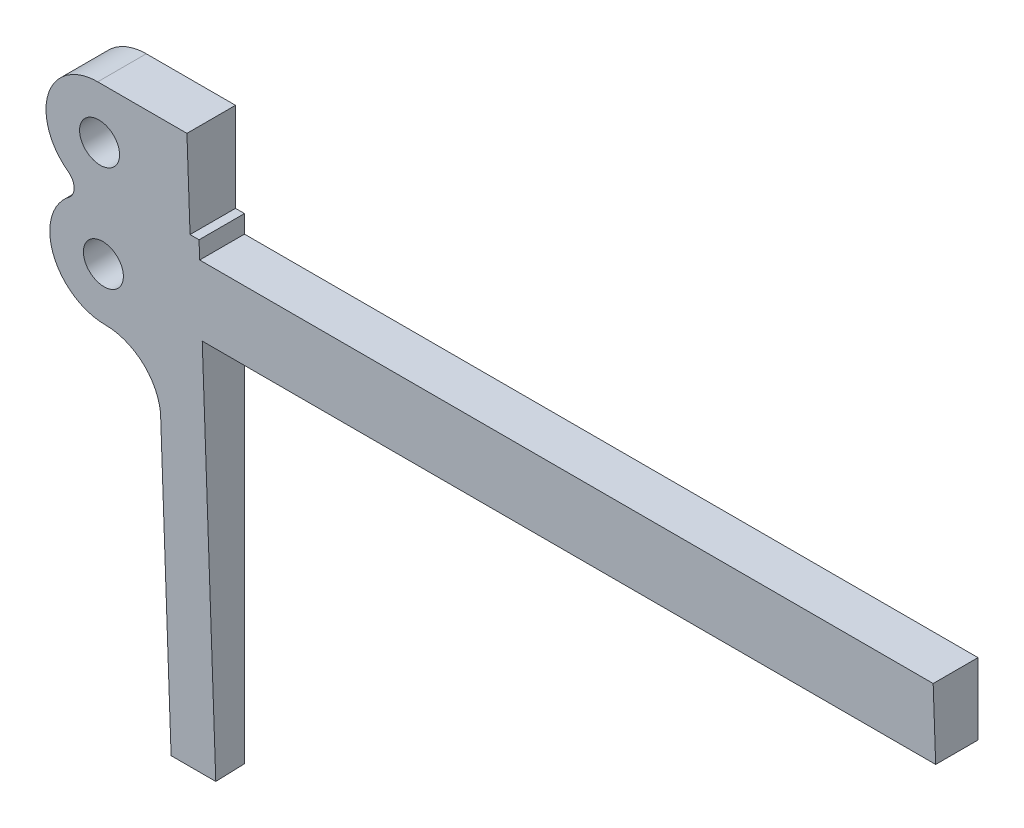
from build123d import *

# Parameters (mm, degrees)
BOSS_EXTRUDE1_OUTLINE_R = 3.556
BOSS_EXTRUDE1_OUTLINE_W = 260.9469
BOSS_EXTRUDE1_OUTLINE_H = 138.1252
BOSS_EXTRUDE1_DEPTH     = 76.2
CUT_EXTRUDE1_DEPTH      = 355.32482824
CUT_EXTRUDE1_DEPTH_BACK = 355.32482824
FILLET1_R               = 2.54
SKETCH7_W               = 260.9469
SKETCH7_H               = 22.1996
CUT_EXTRUDE2_DEPTH      = 347.152897849
FILLET2_R               = 6.35
SKETCH8_W               = 217.439036591
SKETCH8_H               = 235.521960295
CUT_EXTRUDE4_DEPTH      = 347.144751077
SKETCH9_W               = 181.772335281
SKETCH9_H               = 128.639747743
CUT_EXTRUDE5_DEPTH      = 347.144751077


# Read off the part's stored shape, not the designer's step: Boss-Extrude1
with BuildPart() as part:
    # Boss-Extrude1 outline → Boss-Extrude1 (new body)
    with BuildSketch(Plane.XY):
        with BuildLine():
            Line((-286.3596, -22.225), (9.525, -22.225))
            ThreePointArc((9.525, -22.225), (19.05, -12.7), (9.525, -3.175))
            ThreePointArc((9.525, -3.175), (19.05, 6.35), (9.525, 15.875))
            ThreePointArc((9.525, 15.875), (2.789807909, 18.664807909), (0, 25.4))
            Line((0, 25.4), (0, 131.7752))
            ThreePointArc((0, 131.7752), (2.789807909, 138.510392091), (9.525, 141.3002))
            ThreePointArc((9.525, 141.3002), (19.05, 150.8252), (9.525, 160.3502))
            ThreePointArc((9.525, 160.3502), (19.05, 169.8752), (9.525, 179.4002))
            Line((9.525, 179.4002), (-6.35, 179.4002))
            Line((-6.35, 179.4002), (-6.35, 163.5252))
            Line((-6.35, 163.5252), (-7.9502, 163.5252))
            Line((-7.9502, 163.5252), (-7.9502, 160.3502))
            Line((-7.9502, 160.3502), (-268.9098, 160.3502))
            Line((-268.9098, 160.3502), (-268.9098, 163.5252))
            Line((-268.9098, 163.5252), (-270.51, 163.5252))
            Line((-270.51, 163.5252), (-270.51, 179.4002))
            Line((-270.51, 179.4002), (-286.385, 179.4002))
            ThreePointArc((-286.385, 179.4002), (-295.91, 169.8752), (-286.385, 160.3502))
            ThreePointArc((-286.385, 160.3502), (-295.897297883, 150.818850004), (-286.3723, 141.3002))
            ThreePointArc((-286.3723, 141.3002), (-279.637107909, 138.510392091), (-276.8473, 131.7752))
            Line((-276.8473, 131.7752), (-276.8473, 25.4))
            ThreePointArc((-276.8473, 25.4), (-279.637107909, 18.664807909), (-286.3723, 15.875))
            ThreePointArc((-286.3723, 15.875), (-295.8973, 6.35), (-286.3723, -3.175))
            ThreePointArc((-286.3723, -3.175), (-295.884597883, -12.706349996), (-286.3596, -22.225))
        make_face()
        with Locations((-286.3596, -12.7)):
            Circle(BOSS_EXTRUDE1_OUTLINE_R, mode=Mode.SUBTRACT)
        with Locations((-286.3723, 6.35)):
            Circle(BOSS_EXTRUDE1_OUTLINE_R, mode=Mode.SUBTRACT)
        with Locations((9.525, -12.7)):
            Circle(BOSS_EXTRUDE1_OUTLINE_R, mode=Mode.SUBTRACT)
        with Locations((9.525, 6.35)):
            Circle(BOSS_EXTRUDE1_OUTLINE_R, mode=Mode.SUBTRACT)
        with Locations((-286.3723, 150.8252)):
            Circle(BOSS_EXTRUDE1_OUTLINE_R, mode=Mode.SUBTRACT)
        with Locations((-286.385, 169.8752)):
            Circle(BOSS_EXTRUDE1_OUTLINE_R, mode=Mode.SUBTRACT)
        with Locations((-138.42365, 78.5876)):
            Rectangle(BOSS_EXTRUDE1_OUTLINE_W, BOSS_EXTRUDE1_OUTLINE_H, mode=Mode.SUBTRACT)
        with Locations((9.525, 150.8252)):
            Circle(BOSS_EXTRUDE1_OUTLINE_R, mode=Mode.SUBTRACT)
        with Locations((9.525, 169.8752)):
            Circle(BOSS_EXTRUDE1_OUTLINE_R, mode=Mode.SUBTRACT)
    extrude(amount=BOSS_EXTRUDE1_DEPTH)

    # Sketch5 → Cut-Extrude1 (cut, two sides: drawn at the far end of the back side and taken through both)
    with BuildSketch(Plane.ZY.offset(276.8473).offset(-CUT_EXTRUDE1_DEPTH_BACK)):
        Polygon((1.6002, -22.225), (8.641107133, 179.4002), (76.2, 179.4002), (76.2, -22.225), align=None)
    extrude(amount=CUT_EXTRUDE1_DEPTH + CUT_EXTRUDE1_DEPTH_BACK, mode=Mode.SUBTRACT)

    # Fillet1
    fillet1_edges = [part.edges().sort_by_distance(p)[0] for p in [
        (-286.385, 160.3502, 3.987933237),
        (-286.3723, -3.175, 1.132720329),
        (9.525, -3.175, 1.132720329),
        (9.525, 160.3502, 3.987933237),
    ]]
    fillet(fillet1_edges, radius=FILLET1_R)

    # Sketch7 → Cut-Extrude2 (cut, through all)
    with BuildSketch(Plane(origin=(0, 0, 0), x_dir=(-1, 0, 0), z_dir=(0, 0, -1))):
        with Locations((138.42365, -6.35)):
            Rectangle(SKETCH7_W, SKETCH7_H)
    extrude(amount=-CUT_EXTRUDE2_DEPTH, mode=Mode.SUBTRACT)

    # Fillet2
    fillet2_edges = [part.edges().sort_by_distance(p)[0] for p in [
        (-268.8971, 4.7498, 1.271090386),
        (-268.8971, -17.4498, 0.883476829),
        (-7.9502, -17.4498, 0.883476829),
        (-7.9502, 4.7498, 1.271090386),
    ]]
    fillet(fillet2_edges, radius=FILLET2_R)

    # Sketch8 → Cut-Extrude4 (cut, through all)
    with BuildSketch(Plane(origin=(0, -0.082881646, 2.373419811), x_dir=(1, 0, 0), z_dir=(0, -0.03489949670250444, 0.9993908270190958))):
        with Locations((-29.704131704, 74.917246318)):
            Rectangle(SKETCH8_W, SKETCH8_H)
    extrude(amount=-CUT_EXTRUDE4_DEPTH, mode=Mode.SUBTRACT)

    # Sketch9 → Cut-Extrude5 (cut, through all)
    with BuildSketch(Plane(origin=(0, -0.082881646, 2.373419811), x_dir=(1, 0, 0), z_dir=(0, -0.03489949670250444, 0.9993908270190958))):
        with Locations((-229.309817641, 14.398560918)):
            Rectangle(SKETCH9_W, SKETCH9_H)
    extrude(amount=-CUT_EXTRUDE5_DEPTH, mode=Mode.SUBTRACT)


solid = part.part
